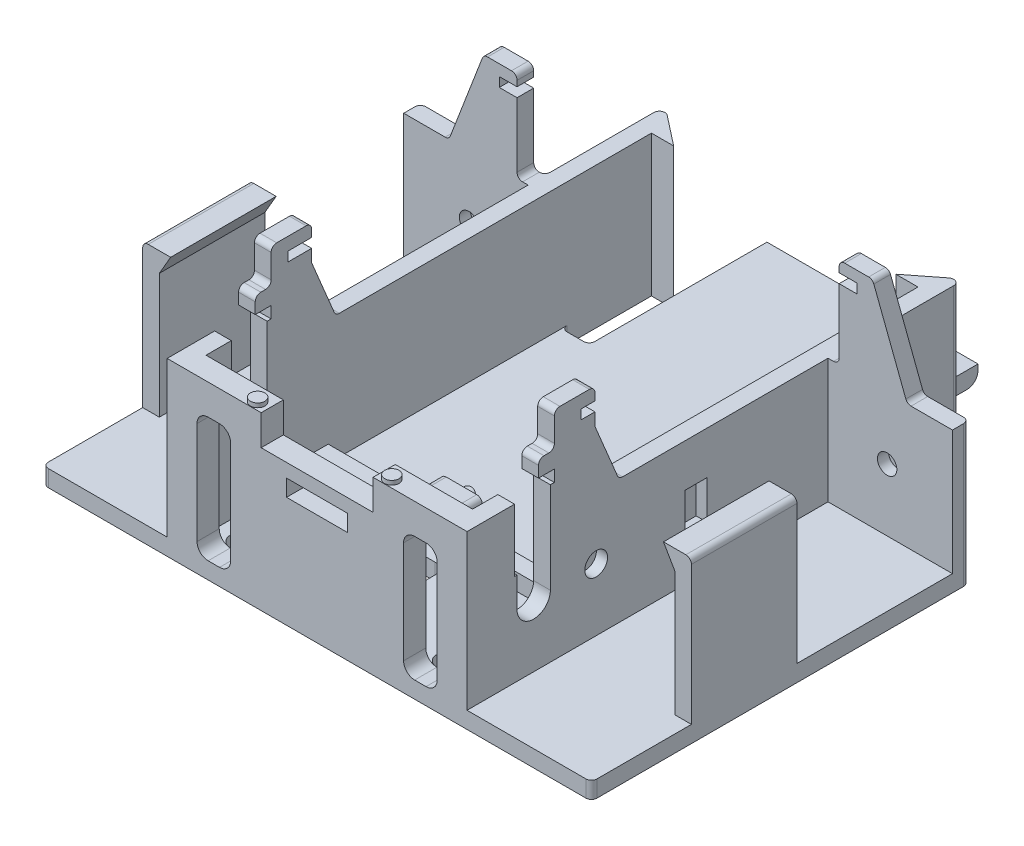
from build123d import *

# Parameters (mm, degrees)
BOSS_EXTRUDE1_DEPTH  = 22.4
SKETCH3_W            = 3
SKETCH3_H            = 19
BOSS_EXTRUDE2_DEPTH  = 22.44
BOSS_EXTRUDE4_START  = -3.551319
BOSS_EXTRUDE4_DEPTH  = 19
CUT_EXTRUDE10_DEPTH  = 32
CUT_EXTRUDE2_START   = -27
SKETCH5_R            = 2.05
SKETCH5_W            = 4
SKETCH5_H            = 7
CUT_EXTRUDE2_DEPTH   = 2
SKETCH12_W           = 24
SKETCH12_H           = 3
BOSS_EXTRUDE7_DEPTH  = 3
BOSS_EXTRUDE8_DEPTH  = 3
CUT_EXTRUDE5_START   = -31.551319
SKETCH28_R           = 1.75
CUT_EXTRUDE5_DEPTH   = 2
BOSS_EXTRUDE21_START = -3
BOSS_EXTRUDE21_DEPTH = 25.4
BOSS_EXTRUDE23_START = -34.551319
BOSS_EXTRUDE23_DEPTH = 3
BOSS_EXTRUDE25_START = -21.444942
BOSS_EXTRUDE25_DEPTH = 3
CUT_EXTRUDE16_DEPTH  = 10
FILLET8_R            = 1
FILLET10_R           = 1
FILLET11_R           = 1
FILLET12_R           = 2
BOSS_EXTRUDE9_START  = -3
SKETCH17_W           = 48
SKETCH17_H           = 4
BOSS_EXTRUDE9_DEPTH  = 25.4
SKETCH38_W           = 3
SKETCH38_H           = 5.5
BOSS_EXTRUDE19_DEPTH = 3.75
BOSS_EXTRUDE20_START = 7.448681
SKETCH39_R           = 1.5
BOSS_EXTRUDE20_DEPTH = 3
CUT_EXTRUDE7_START   = 3.75
CUT_EXTRUDE7_DEPTH   = 9
SKETCH42_W           = 48
SKETCH42_H           = 19
BOSS_EXTRUDE22_DEPTH = 3
FILLET9_R            = 1
CUT_EXTRUDE11_START  = 21.555058
SKETCH46_W           = 2.542514337
SKETCH46_H           = 1.7
CUT_EXTRUDE11_DEPTH  = 10
CUT_EXTRUDE12_START  = -24.444942
SKETCH47_W           = 3.691916295
SKETCH47_H           = 1.7
CUT_EXTRUDE12_DEPTH  = 8
CUT_EXTRUDE13_START  = 35.021307
CUT_EXTRUDE13_DEPTH  = 1.7
SKETCH49_W           = 6.05
SKETCH49_H           = 22.4
CUT_EXTRUDE14_DEPTH  = 10
CUT_EXTRUDE15_START  = 39.621307
SKETCH50_W           = 16.22
SKETCH50_H           = 6.05
CUT_EXTRUDE15_DEPTH  = 10
BOSS_EXTRUDE27_DEPTH = 5.465787512
FILLET13_R           = 1
FILLET14_R           = 2
FILLET15_R           = 2
BOSS_EXTRUDE28_START = 8.755519
SKETCH53_R           = 1.3
BOSS_EXTRUDE28_DEPTH = 0.75
CUT_EXTRUDE17_START  = 33.448681
SKETCH54_W           = 11
SKETCH54_H           = 3
CUT_EXTRUDE17_DEPTH  = 10


# Some blends are built 0.0001 mm under size
with BuildPart() as part:
    # Sketch1 → Boss-Extrude1 (new body)
    with BuildSketch(Plane(origin=(0, 0, 0), x_dir=(1, 0, 0), z_dir=(0, 1, 0))):
        Polygon((-24, -33.448680509), (-24, 34.551319491), (-49.4, 34.551319491), (-49.4, 31.551319491), (-27, 31.551319491), (-27, -33.448680509), align=None)
    extrude(amount=BOSS_EXTRUDE1_DEPTH)

    # Sketch7 → Cut-Extrude10 (cut)
    with BuildSketch(Plane(origin=(0, 0, 0), x_dir=(0, 0, -1), z_dir=(1, 0, 0))):
        with BuildLine():
            Line((-24.448680509, 11.22), (-24.448680509, 27.377927261))
            ThreePointArc((-24.448680509, 27.377927261), (-21.448680509, 30.377927261), (-18.448680509, 27.377927261))
            Line((-18.448680509, 27.377927261), (-18.448680509, 11.22))
            ThreePointArc((-18.448680509, 11.22), (-21.448680509, 8.22), (-24.448680509, 11.22))
        make_face()
    extrude(amount=-CUT_EXTRUDE10_DEPTH, mode=Mode.SUBTRACT)

    # Sketch5 → Cut-Extrude2 (cut)
    with BuildSketch(Plane(origin=(0, 0, 0), x_dir=(0, 0, -1), z_dir=(1, 0, 0)).offset(CUT_EXTRUDE2_START)):
        with Locations((-10.198680509, 11.22)):
            Circle(SKETCH5_R)
        with Locations((7.801319491, 11.18)):
            Rectangle(SKETCH5_W, SKETCH5_H)
    extrude(amount=CUT_EXTRUDE2_DEPTH, mode=Mode.SUBTRACT)

    # Sketch12 → Boss-Extrude7 (add)
    with BuildSketch(Plane(origin=(0, 0, 0), x_dir=(1, 0, 0), z_dir=(0, 1, 0))):
        with Locations((-12, -8.948680509)):
            Rectangle(SKETCH12_W, SKETCH12_H)
    extrude(amount=BOSS_EXTRUDE7_DEPTH)



with BuildPart() as body_2:
    # Sketch3 → Boss-Extrude2 (new body)
    with BuildSketch(Plane(origin=(0, 0, 0), x_dir=(1, 0, 0), z_dir=(0, 1, 0))):
        with Locations((-47.9, -5.948680509)):
            Rectangle(SKETCH3_W, SKETCH3_H)
    extrude(amount=BOSS_EXTRUDE2_DEPTH)

    # Sketch4 → Boss-Extrude4 (add)
    with BuildSketch(Plane.XY.offset(BOSS_EXTRUDE4_START)):
        Polygon((-46.4, 22.44), (-44.373193613, 25.95053164), (-49.4, 25.95053164), (-49.4, 22.44), align=None)
    extrude(amount=BOSS_EXTRUDE4_DEPTH)


with BuildPart() as part_1:
    add(part.part)

    add(body_2.part)  # Boss-Extrude8 merges body 2
    # Sketch13 → Boss-Extrude8 (add)
    with BuildSketch(Plane(origin=(0, 0, 0), x_dir=(1, 0, 0), z_dir=(0, 1, 0))):
        Polygon((-49.4, 3.551319491), (-49.4, 34.551319491), (-19, 34.551319491), (-19, 66.551319491), (0, 66.551319491), (0, 34.551319491), (0, -10.448680509), (-24, -10.448680509), (-24, -33.448680509), (-49.4, -33.448680509), (-49.4, -17.448680509), align=None)
    extrude(amount=-BOSS_EXTRUDE8_DEPTH)

    # Sketch28 → Cut-Extrude5 (cut)
    with BuildSketch(Plane.XY.offset(CUT_EXTRUDE5_START)):
        with Locations(Location((-37.640407611, 11.22, 0), (0, 0, 180))):
            Circle(SKETCH28_R)
    extrude(amount=-CUT_EXTRUDE5_DEPTH, mode=Mode.SUBTRACT)

    # Sketch41 → Boss-Extrude21 (add)
    with BuildSketch(Plane(origin=(0, 0, 0), x_dir=(1, 0, 0), z_dir=(0, 1, 0)).offset(BOSS_EXTRUDE21_START)):
        Polygon((-27, 34.551319491), (-27, 56.23235781), (-20, 50.751319491), (-24, 50.751319491), (-24, 34.551319491), align=None)
    extrude(amount=BOSS_EXTRUDE21_DEPTH)

    # Sketch44 → Boss-Extrude23 (add)
    with BuildSketch(Plane.XY.offset(BOSS_EXTRUDE23_START)):
        Polygon((-35, 22.4), (-29, 22.4), (-29, 35.021306871), (-32.2, 35.021306871), (-32.2, 36.721306871), (-29, 36.721306871), (-29, 38.721306871), (-35, 38.721306871), (-41.25512771, 22.4), align=None)
    extrude(amount=BOSS_EXTRUDE23_DEPTH)

    # Sketch45 → Boss-Extrude25 (add)
    with BuildSketch(Plane(origin=(-2.555057538, -1.794086287, 4.021938541), x_dir=(0, 0, -1), z_dir=(1, 0, 0)).offset(BOSS_EXTRUDE25_START)):
        Polygon((-6.403652101, 34.55338546), (-2.08892334, 24.194086287), (-6.386952941, 24.194086287), (-14.426741968, 24.194086287), (-14.426741968, 29.459873799), (-13.701741968, 29.459873799), (-13.701741968, 31.559873799), (-16.564074998, 31.559873799), (-16.564074998, 34.55338546), (-13.701741968, 34.55338546), (-13.701741968, 40.824958595), (-6.403652101, 40.824958595), align=None)
    extrude(amount=-BOSS_EXTRUDE25_DEPTH)

    # Sketch51 → Cut-Extrude16 (cut)
    with BuildSketch(Plane.ZY.offset(27)):
        Polygon((24.448680509, 16.565787512), (24.898680509, 16.565787512), (24.898680509, 22.4), (24.084753225, 22.4), (24.084753225, 16.565787512), align=None)
    extrude(amount=-CUT_EXTRUDE16_DEPTH, mode=Mode.SUBTRACT)

    # Mirror1: part across plane


with BuildPart() as part_2:
    add(part_1.part)
    add(part_1.part.mirror(Plane(origin=(0, 0, 0), x_dir=(0, 0, 1), z_dir=(1, 0, 0))))

    # Fillet8
    fillet8_edges = [part_2.edges().sort_by_distance(p)[0] for p in [
        (49.4, 9.7, -34.551319491),
        (49.4, -1.5, 33.448680509),
        (27, 9.7, -56.23235781),
        (27, 9.7, -34.551319491),
        (-49.4, -1.5, 33.448680509),
        (-49.4, 9.7, -34.551319491),
        (-27, 9.7, -34.551319491),
        (-27, 9.7, -56.23235781),
    ]]
    fillet(fillet8_edges, radius=FILLET8_R)

    # Fillet10
    fillet10_edges = [part_2.edges().sort_by_distance(p)[0] for p in [
        (24, -1.5, -34.551319491),
        (19, -1.5, -34.551319491),
        (-19, -1.5, -34.551319491),
        (-24, -1.5, -34.551319491),
    ]]
    fillet(fillet10_edges, radius=FILLET10_R)

    # Fillet11
    fillet11_edges = [part_2.edges().sort_by_distance(p)[0] for p in [
        (-49.4, 25.95053164, 5.948681),
        (49.4, 25.95053164, 5.948681),
    ]]
    fillet(fillet11_edges, radius=FILLET11_R)

    # Fillet12
    fillet12_edges = [part_2.edges().sort_by_distance(p)[0] for p in [
        (0, -3, -66.551319491),
    ]]
    fillet(fillet12_edges, radius=FILLET12_R)

    # Sketch17 → Boss-Extrude9 (add)
    with BuildSketch(Plane(origin=(0, 0, 0), x_dir=(1, 0, 0), z_dir=(0, 1, 0)).offset(BOSS_EXTRUDE9_START)):
        with Locations((0, -31.448680509)):
            Rectangle(SKETCH17_W, SKETCH17_H)
    extrude(amount=BOSS_EXTRUDE9_DEPTH)

    # Sketch38 → Boss-Extrude19 (add, symmetric)
    with BuildSketch(Plane(origin=(0, 0, 0), x_dir=(0, 0, -1), z_dir=(1, 0, 0))):
        with Locations((-8.948680509, 5.75)):
            Rectangle(SKETCH38_W, SKETCH38_H)
    extrude(amount=BOSS_EXTRUDE19_DEPTH, both=True)

    # Sketch39 → Boss-Extrude20 (add)
    with BuildSketch(Plane.XY.offset(BOSS_EXTRUDE20_START)):
        with Locations((0, 6)):
            Circle(SKETCH39_R)
    extrude(amount=-BOSS_EXTRUDE20_DEPTH)

    # Sketch40 → Cut-Extrude7 (cut)
    with BuildSketch(Plane(origin=(0, 0, 0), x_dir=(0, 0, -1), z_dir=(1, 0, 0)).offset(CUT_EXTRUDE7_START)):
        Polygon((-7.448680509, 4.5), (-4.448680509, 9.696152423), (-4.448680509, 4.5), align=None)
    extrude(amount=-CUT_EXTRUDE7_DEPTH, mode=Mode.SUBTRACT)

    # Sketch42 → Boss-Extrude22 (add)
    with BuildSketch(Plane(origin=(0, 0, 0), x_dir=(1, 0, 0), z_dir=(0, 1, 0))):
        with Locations((0, -19.948680509)):
            Rectangle(SKETCH42_W, SKETCH42_H)
    extrude(amount=-BOSS_EXTRUDE22_DEPTH)

    # Fillet9
    fillet9_edges = [part_2.edges().sort_by_distance(p)[0] for p in [
        (-3.75, 3, 8.948680509),
        (-3.75, 8.5, 8.948680509),
        (3.75, 3, 8.948680509),
        (3.75, 8.5, 8.948680509),
    ]]
    fillet(fillet9_edges, radius=FILLET9_R)

    # Sketch46 → Cut-Extrude11 (cut)
    with BuildSketch(Plane(origin=(-2.555057538, -1.794086287, 4.021938541), x_dir=(0, 0, -1), z_dir=(1, 0, 0)).offset(CUT_EXTRUDE11_START)):
        with Locations((-7.67490927, 37.665393158)):
            Rectangle(SKETCH46_W, SKETCH46_H)
    extrude(amount=CUT_EXTRUDE11_DEPTH, mode=Mode.SUBTRACT)

    # Sketch47 → Cut-Extrude12 (cut)
    with BuildSketch(Plane(origin=(-2.555057538, -1.794086287, 4.021938541), x_dir=(0, 0, -1), z_dir=(1, 0, 0)).offset(CUT_EXTRUDE12_START)):
        with Locations((-8.249610249, 37.665393158)):
            Rectangle(SKETCH47_W, SKETCH47_H)
    extrude(amount=CUT_EXTRUDE12_DEPTH, mode=Mode.SUBTRACT)

    # Sketch48 → Cut-Extrude13 (cut)
    with BuildSketch(Plane(origin=(0, 0, 0), x_dir=(1, 0, 0), z_dir=(0, 1, 0)).offset(CUT_EXTRUDE13_START)):
        Polygon((-24.847047065, -13.843105241), (-23.678138979, -15.012013327), (-22.990749091, -15.012013327), (-22.990749091, -13.843105241), align=None)
        Polygon((27.920536062, -11.792448738), (25.706921794, -13.763748981), (23.36384329, -13.763748981), (23.36384329, -11.792448738), align=None)
    extrude(amount=CUT_EXTRUDE13_DEPTH, mode=Mode.SUBTRACT)

    # Sketch49 → Cut-Extrude14 (cut)
    with BuildSketch(Plane.XY.offset(33.448680509)):
        with Locations((-18.595300381, 11.2)):
            Rectangle(SKETCH49_W, SKETCH49_H)
    cut_extrude14 = extrude(amount=-CUT_EXTRUDE14_DEPTH, mode=Mode.SUBTRACT)

    # Sketch50 → Cut-Extrude15 (cut)
    with BuildSketch(Plane(origin=(-0.244699088, 36.621306871, -23.704871388), x_dir=(0, 0, -1), z_dir=(0, -1, 0)).offset(CUT_EXTRUDE15_START)):
        with Locations((-45.043551898, -18.350601293)):
            Rectangle(SKETCH50_W, SKETCH50_H)
        with Locations((-45.043551898, 0.244699088)):
            Rectangle(SKETCH50_W, SKETCH50_H)
    cut_extrude15 = extrude(amount=-CUT_EXTRUDE15_DEPTH, mode=Mode.SUBTRACT)

    # Sketch52 → Boss-Extrude27 (add)
    with BuildSketch(Plane(origin=(0, 22.4, 0), x_dir=(1, 0, 0), z_dir=(0, 1, 0))):
        Polygon((-27, -24.898680509), (-27, -33.448680509), (-10.074944702, -33.448680509), (-10.074944702, -29.448680509), (-24, -29.448680509), (-24, -24.898680509), align=None)
    boss_extrude27 = extrude(amount=BOSS_EXTRUDE27_DEPTH)

    # Mirror2: Cut-Extrude14, Cut-Extrude15, Boss-Extrude27 across plane
    add(cut_extrude14.mirror(Plane(origin=(0, 0, 0), x_dir=(0, 0, 1), z_dir=(1, 0, 0))), mode=Mode.SUBTRACT)
    add(cut_extrude15.mirror(Plane(origin=(0, 0, 0), x_dir=(0, 0, 1), z_dir=(1, 0, 0))), mode=Mode.SUBTRACT)
    add(boss_extrude27.mirror(Plane(origin=(0, 0, 0), x_dir=(0, 0, 1), z_dir=(1, 0, 0))))

    # Fillet13
    fillet13_edges = [part_2.edges().sort_by_distance(p)[0] for p in [
        (-29, 38.721306871, -33.051319),
        (-35, 38.721306871, -33.051319),
        (-41.25512771, 22.4, -33.051319245),
        (-29, 22.4, -33.051319245),
        (-25.499999538, 32.759299173, 20.586013539),
        (-25.499999538, 32.759299173, 17.723680509),
        (-25.499999538, 39.030872308, 17.723680509),
        (-25.499999538, 39.030872308, 10.425590643),
        (-25.499999769, 22.4, 6.110861882),
        (29, 22.4, -33.051319245),
        (29, 38.721306871, -33.051319),
        (35, 38.721306871, -33.051319),
        (41.25512771, 22.4, -33.051319245),
        (25.499999538, 32.759299173, 20.586013539),
        (25.499999538, 32.759299173, 17.723680509),
        (25.499999538, 39.030872308, 17.723680509),
        (25.499999538, 39.030872308, 10.425590643),
        (25.499999769, 22.4, 6.110861882),
    ]]
    fillet(fillet13_edges, radius=FILLET13_R)

    # Fillet14
    # the kernel refuses this fillet: 2 mm, written as the material it adds along each edge
    with BuildSketch(Plane(origin=(-21.620300381, 0, 33.448680509), x_dir=(1, 0, 0), z_dir=(0, 0, -1)), Plane(origin=(-21.620300381, 22.4, 33.448680509), x_dir=(0, -1, 0), z_dir=(0, 0, -1)), Plane(origin=(-15.570300381, 22.4, 33.448680509), x_dir=(-1, 0, 0), z_dir=(0, 0, -1)), Plane(origin=(21.620300381, 22.4, 33.448680509), x_dir=(-1, 0, 0), z_dir=(0, 0, -1)), Plane(origin=(15.570300381, 0, 33.448680509), x_dir=(1, 0, 0), z_dir=(0, 0, -1)), Plane(origin=(15.570300381, 22.4, 33.448680509), x_dir=(0, -1, 0), z_dir=(0, 0, -1))) as fillet14_piece_1:
        with BuildLine():
            CenterArc((FILLET14_R, -FILLET14_R), FILLET14_R, 90, 90)
            Line((0, -FILLET14_R), (0, 0))
            Line((0, 0), (FILLET14_R, 0))
        make_face()
    extrude(amount=4)
    with BuildSketch(Plane(origin=(-15.570300381, 0, 33.448680509), x_dir=(-1, 0, 0), z_dir=(0, 0, -1)), Plane(origin=(21.620300381, 0, 33.448680509), x_dir=(-1, 0, 0), z_dir=(0, 0, -1))) as fillet14_piece_2:
        with BuildLine():
            CenterArc((FILLET14_R, FILLET14_R), FILLET14_R, 180, 90)
            Line((0, FILLET14_R), (0, 0))
            Line((0, 0), (FILLET14_R, 0))
        make_face()
    extrude(amount=4)

    # Fillet15
    fillet15_edges = [part_2.edges().sort_by_distance(p)[0] for p in [
        (-21.620300381, -1.500000065, 13.228680509),
        (-21.620300381, -1.500000065, 29.448680509),
        (-15.570300381, -1.500000065, 29.448680509),
        (-15.570300381, -1.500000065, 13.228680509),
        (3.025, -1.500000065, 29.448680509),
        (3.025, -1.500000065, 13.228680509),
        (-3.025, -1.500000065, 13.228680509),
        (-3.025, -1.500000065, 29.448680509),
        (21.620300381, -1.500000065, 29.448680509),
        (21.620300381, -1.500000065, 13.228680509),
        (15.570300381, -1.500000065, 13.228680509),
        (15.570300381, -1.500000065, 29.448680509),
    ]]
    fillet(fillet15_edges, radius=FILLET15_R - 0.0001)  # a hair under: the kernel refuses the full size


with BuildPart() as boss_extrude28_tool:
    # Sketch53 → Boss-Extrude28 (new body)
    with BuildSketch(Plane(origin=(-0.244699088, 36.621306871, -23.704871388), x_dir=(0, 0, -1), z_dir=(0, -1, 0)).offset(BOSS_EXTRUDE28_START)):
        with Locations((-55.778551898, -11.830245614)):
            Circle(SKETCH53_R)
        with Locations((-55.778551898, 12.31964379)):
            Circle(SKETCH53_R)
    extrude(amount=-BOSS_EXTRUDE28_DEPTH)


with BuildPart() as part_3:
    add(part_2.part)


with BuildPart() as part_4:
    # Boss-Extrude28: joined with boss_extrude28_tool
    add(part_3.part.fuse(boss_extrude28_tool.part, tol=0.00001))

    # Sketch54 → Cut-Extrude17 (cut)
    with BuildSketch(Plane.XY.offset(CUT_EXTRUDE17_START)):
        with Locations((0, 18.456055662)):
            Rectangle(SKETCH54_W, SKETCH54_H)
    extrude(amount=-CUT_EXTRUDE17_DEPTH, mode=Mode.SUBTRACT)


solid = part_4.part
